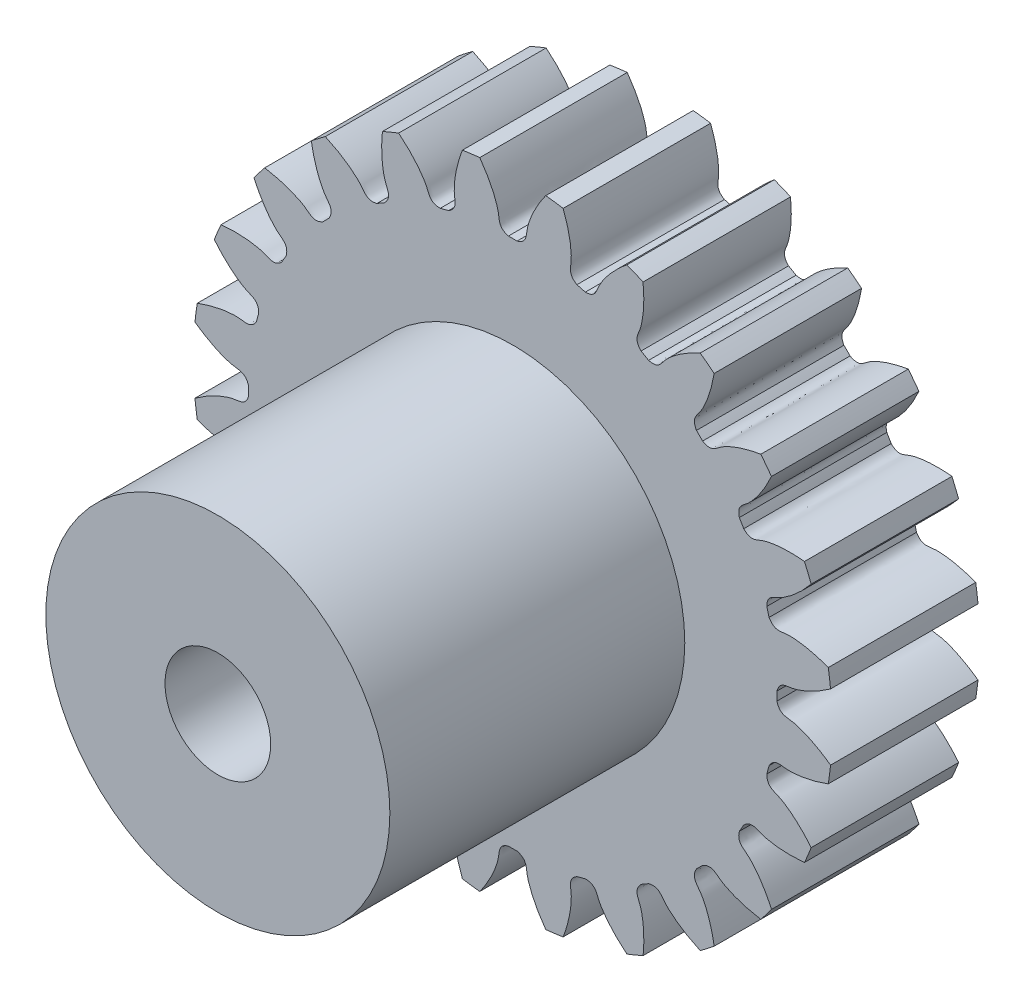
from build123d import *

# Parameters (mm, degrees)
SKETCH_1_R               = 6.5
EXTRUDE_1_DEPTH          = 3
CUT_EXTRUDE_1_DEPTH      = 10.669539803
PATTERN_CIRCULAR_1_COUNT = 24
SKETCH_5_R               = 3.5
EXTRUDE_2_DEPTH          = 6
CUT_EXTRUDE_2_REACH      = 15.936
CUT_EXTRUDE_START        = -3
SKETCH_4_R               = 1.075


with BuildPart() as part:
    # 草图1 → 凸台-拉伸1 (new body)
    with BuildSketch(Plane.XY):
        Circle(SKETCH_1_R)
    extrude(amount=EXTRUDE_1_DEPTH)

    # 草图2 → 切除-拉伸1 (cut, through all)
    with BuildSketch(Plane.XY):
        with BuildLine():
            ThreePointArc((0.088415956, 5.374272753), (0, 5.375), (-0.088415956, 5.374272753))
            add(Edge.make_bspline(
                [(-0.088415956, 5.374272753), (-0.283956108, 5.428430036), (-0.269523883, 5.557861799), (-0.293138588, 5.686342226), (-0.296517959, 5.702916521), (-0.300724242, 5.721620073), (-0.305840304, 5.742426358), (-0.311952817, 5.765305336), (-0.319146149, 5.790224685), (-0.327504211, 5.817149434), (-0.337109789, 5.846042111), (-0.348044663, 5.876862729), (-0.360389484, 5.909568827), (-0.374223721, 5.944115495), (-0.389625595, 5.980455405), (-0.406672011, 6.018538843), (-0.425438499, 6.058313744), (-0.445999145, 6.099725726), (-0.468426535, 6.142718129), (-0.492791687, 6.187232054), (-0.519163995, 6.233206399), (-0.547611171, 6.280577906), (-0.57819918, 6.329281201), (-0.610992189, 6.379248841), (-0.64605251, 6.430411359), (-0.68344054, 6.482697309), (-0.723214712, 6.53603332), (-0.765431443, 6.590344144), (-0.810145078, 6.645552705), (-0.857407842, 6.701580158), (-0.907269792, 6.758345935), (-0.959778768, 6.81576781), (-1.014980347, 6.873761948), (-1.0729178, 6.932242967), (-1.133632047, 6.991123994), (-1.197161611, 7.05031673), (-1.263542589, 7.109731505), (-1.332808587, 7.169277345), (-1.430211047, 7.249680778), (-1.505961903, 7.308439159), (-1.55780976, 7.347058965)],
                knots=[0, 0, 0, 0, 0.143961355, 0.149818462, 0.156576662, 0.164235955, 0.172796342, 0.182257821, 0.192620395, 0.203884061, 0.216048821, 0.229114674, 0.24308162, 0.25794966, 0.273718793, 0.290389019, 0.307960339, 0.326432751, 0.345806258, 0.366080857, 0.38725655, 0.409333336, 0.432311215, 0.456190188, 0.480970254, 0.506651413, 0.533233666, 0.560717012, 0.589101451, 0.618386984, 0.64857361, 0.679661329, 0.711650141, 0.744540047, 0.778331046, 0.813023138, 0.848616324, 0.885110603, 0.922505975, 1, 1, 1, 1], degree=3))
            ThreePointArc((-1.55780976, 7.347058965), (0, 7.510395907), (1.55780976, 7.347058965))
            add(Edge.make_bspline(
                [(0.088415956, 5.374272753), (0.283956108, 5.428430036), (0.269523883, 5.557861799), (0.293138588, 5.686342226), (0.296517959, 5.702916521), (0.300724242, 5.721620073), (0.305840304, 5.742426358), (0.311952817, 5.765305336), (0.319146149, 5.790224685), (0.327504211, 5.817149434), (0.337109789, 5.846042111), (0.348044663, 5.876862729), (0.360389484, 5.909568827), (0.374223721, 5.944115495), (0.389625595, 5.980455405), (0.406672011, 6.018538843), (0.425438499, 6.058313744), (0.445999145, 6.099725726), (0.468426535, 6.142718129), (0.492791687, 6.187232054), (0.519163995, 6.233206399), (0.547611171, 6.280577906), (0.57819918, 6.329281201), (0.610992189, 6.379248841), (0.64605251, 6.430411359), (0.68344054, 6.482697309), (0.723214712, 6.53603332), (0.765431443, 6.590344144), (0.810145078, 6.645552705), (0.857407842, 6.701580158), (0.907269792, 6.758345935), (0.959778768, 6.81576781), (1.014980347, 6.873761948), (1.0729178, 6.932242967), (1.133632047, 6.991123994), (1.197161611, 7.05031673), (1.263542589, 7.109731505), (1.332808587, 7.169277345), (1.430211047, 7.249680778), (1.505961903, 7.308439159), (1.55780976, 7.347058965)],
                knots=[0, 0, 0, 0, 0.143961355, 0.149818462, 0.156576662, 0.164235955, 0.172796342, 0.182257821, 0.192620395, 0.203884061, 0.216048821, 0.229114674, 0.24308162, 0.25794966, 0.273718793, 0.290389019, 0.307960339, 0.326432751, 0.345806258, 0.366080857, 0.38725655, 0.409333336, 0.432311215, 0.456190188, 0.480970254, 0.506651413, 0.533233666, 0.560717012, 0.589101451, 0.618386984, 0.64857361, 0.679661329, 0.711650141, 0.744540047, 0.778331046, 0.813023138, 0.848616324, 0.885110603, 0.922505975, 1, 1, 1, 1], degree=3))
        make_face()
    cut_extrude_1 = extrude(amount=CUT_EXTRUDE_1_DEPTH, mode=Mode.SUBTRACT)

    # 阵列(圆周)1: 切除-拉伸1 ×24 about axis
    pattern_circular_1_axis = Axis((0, 0, 3), (0, 0, -1))
    for i in range(1, PATTERN_CIRCULAR_1_COUNT):
        add(cut_extrude_1.rotate(pattern_circular_1_axis, i * 360 / PATTERN_CIRCULAR_1_COUNT), mode=Mode.SUBTRACT)

    # 草图5 → 凸台-拉伸2 (add)
    with BuildSketch(Plane.XY.offset(3)):
        Circle(SKETCH_5_R)
    extrude(amount=EXTRUDE_2_DEPTH)

    # 草图4 → 切除-拉伸2 (cut, up to next)
    with BuildSketch(Plane.XY.offset(3).offset(CUT_EXTRUDE_START), mode=Mode.PRIVATE) as cut_extrude_2_sk1:
        Circle(SKETCH_4_R)
    cut_extrude_2_tool1 = extrude(cut_extrude_2_sk1.sketch, amount=CUT_EXTRUDE_2_REACH, mode=Mode.PRIVATE) & part.part
    add(cut_extrude_2_tool1.solids().sort_by_distance((0, 0, 0))[0], mode=Mode.SUBTRACT)


solid = part.part
